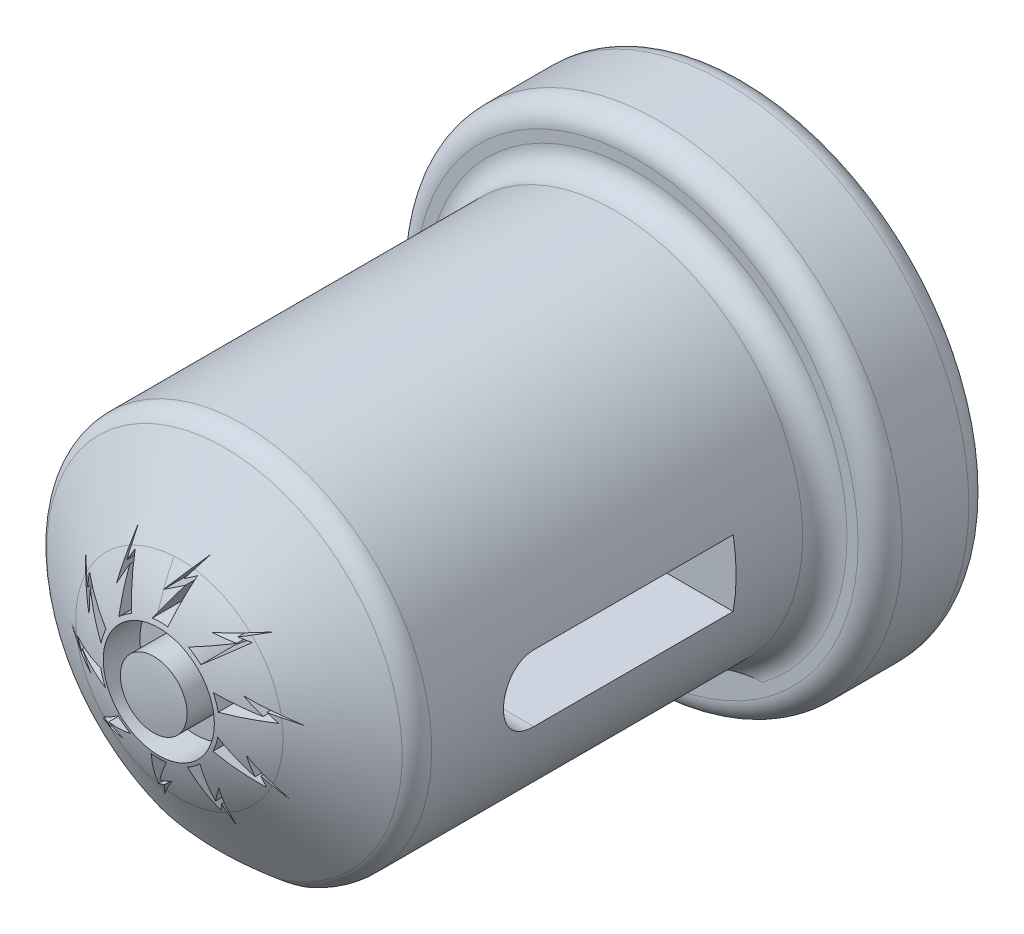
from build123d import *

# Parameters (mm, degrees)
SALIENTE_EXTRUIR1_DEPTH = 23.3
CROQUIS2_R              = 11
SALIENTE_EXTRUIR2_DEPTH = 5
CORTAR_EXTRUIR1_REACH   = 30.016
REDONDEO3_R             = 1
REDONDEO2_R             = 1
CROQUIS5_R              = 2.5
CROQUIS5_R_2            = 1.5
CORTAR_EXTRUIR2_DEPTH   = 2
CHAFL_N1_SIZE           = 0.5
CORTAR_EXTRUIR3_REACH   = 37.025


with BuildPart() as part:
    # Croquis1 → Saliente-Extruir1 (new body)
    with BuildSketch(Plane.XY):
        with BuildLine():
            Line((3.786999687, -7.609772229), (-3.786999687, -7.609772229))
            ThreePointArc((-3.786999687, -7.609772229), (0, 8.5), (3.786999687, -7.609772229))
        make_face()
        with BuildLine():
            Line((3, -4.609772229), (-3, -4.609772229))
            ThreePointArc((-3, -4.609772229), (0, 5.5), (3, -4.609772229))
        make_face(mode=Mode.SUBTRACT)
    extrude(amount=SALIENTE_EXTRUIR1_DEPTH)

    # Croquis2 → Saliente-Extruir2 (add)
    with BuildSketch(Plane(origin=(0, 0, 0), x_dir=(-1, 0, 0), z_dir=(0, 0, -1))):
        Circle(CROQUIS2_R)
        with BuildLine():
            Line((3, -4.609772229), (-3, -4.609772229))
            ThreePointArc((-3, -4.609772229), (0, 5.5), (3, -4.609772229))
        make_face(mode=Mode.SUBTRACT)
    extrude(amount=-SALIENTE_EXTRUIR2_DEPTH)

    # Croquis3 → Revolución1 (revolve)
    with BuildSketch(Plane(origin=(0, 0, 0), x_dir=(0, 0, -1), z_dir=(1, 0, 0))):
        with BuildLine():
            Line((-23.3, 0), (-23.3, 8.5))
            Line((-23.3, 8.5), (-25.625227866, 4.675672007))
            ThreePointArc((-25.625227866, 4.675672007), (-26.601446105, 2.427842124), (-26.935098395, 0))
            Line((-26.935098395, 0), (-23.3, 0))
        make_face()
    revolve(axis=Axis((0, 0, 26.935098395), (0, 0, -1)))

    # Croquis4 → Cortar-Extruir1 (cut, up to next)
    with BuildSketch(Plane(origin=(0, 0, 23.3), x_dir=(-1, 0, 0), z_dir=(0, 0, -1)), mode=Mode.PRIVATE) as cortar_extruir1_sk1:
        with BuildLine():
            Line((3.786999687, -7.609772229), (-3.786999687, -7.609772229))
            ThreePointArc((-3.786999687, -7.609772229), (0, -8.5), (3.786999687, -7.609772229))
        make_face()
    cortar_extruir1_tool1 = extrude(cortar_extruir1_sk1.sketch, amount=-CORTAR_EXTRUIR1_REACH, mode=Mode.PRIVATE) & part.part
    add(cortar_extruir1_tool1.solids().sort_by_distance((0, -7.967512, 23.3))[0], mode=Mode.SUBTRACT)

    # Redondeo3
    redondeo3_edges = [part.edges().sort_by_distance(p)[0] for p in [
        (11, 0, 0),
        (11, 0, 5),
        (0, 8.5, 5),
        (-8.274450554, 1.945113886, 23.3),
    ]]
    fillet(redondeo3_edges, radius=REDONDEO3_R)

    # Redondeo2
    redondeo2_edges = [part.edges().sort_by_distance(p)[0] for p in [
        (0, -4.609772229, 0),
        (0, 5.5, 0),
    ]]
    fillet(redondeo2_edges, radius=REDONDEO2_R)

    # Croquis5 → Cortar-Extruir2 (cut)
    # profile 1 of 11: a face of its own
    with BuildSketch(Plane.XY.offset(26.935098395)):
        with Locations((0.025979011, -0.015198441)):
            Circle(CROQUIS5_R)
        with Locations((0.025979011, -0.015198441)):
            Circle(CROQUIS5_R_2, mode=Mode.SUBTRACT)
    # profile 2 of 11: a face of its own
    with BuildSketch(Plane.XY.offset(26.935098395)):
        with BuildLine():
            Line((1.302557766, 2.344074393), (2.881616708, 2.973814702))
            Line((2.881616708, 2.973814702), (1.998734761, 3.074340177))
            Line((1.998734761, 3.074340177), (3.892874702, 3.589350961))
            Line((3.892874702, 3.589350961), (2.860263918, 3.177538192))
            Line((2.860263918, 3.177538192), (3.350806324, 3.121684736))
            Line((3.350806324, 3.121684736), (1.868869662, 1.932624716))
            ThreePointArc((1.868869662, 1.932624716), (1.599104223, 2.156780008), (1.302557766, 2.344074393))
        make_face()
    # profile 3 of 11: a face of its own
    with BuildSketch(Plane.XY.offset(26.935098395)):
        with BuildLine():
            Line((-0.324020989, 2.662020265), (0.583312464, 4.099638436))
            Line((0.583312464, 4.099638436), (-0.190041428, 3.662020265))
            Line((-0.190041428, 3.662020265), (1.039634231, 5.192020265))
            Line((1.039634231, 5.192020265), (0.44629203, 4.251903346))
            Line((0.44629203, 4.251903346), (0.875979011, 4.495050543))
            Line((0.875979011, 4.495050543), (0.375979011, 2.662020265))
            ThreePointArc((0.375979011, 2.662020265), (0.025979011, 2.684801559), (-0.324020989, 2.662020265))
        make_face()
    # profile 4 of 11: a face of its own
    with BuildSketch(Plane.XY.offset(26.935098395)):
        with BuildLine():
            Line((2.431603727, 1.130771774), (4.079241313, 0.712094828))
            Line((4.079241313, 0.712094828), (3.424062205, 1.312366634))
            Line((3.424062205, 1.312366634), (5.259169351, 0.615671587))
            Line((5.259169351, 0.615671587), (4.181712206, 0.889461449))
            Line((4.181712206, 0.889461449), (4.545739511, 0.555941462))
            Line((4.545739511, 0.555941462), (2.647915623, 0.465032213))
            ThreePointArc((2.647915623, 0.465032213), (2.561425973, 0.804941801), (2.431603727, 1.130771774))
        make_face()
    # profile 5 of 11: a face of its own
    with BuildSketch(Plane.XY.offset(26.935098395)):
        with BuildLine():
            Line((2.631859712, -0.514447228), (3.718734384, -1.821621067))
            Line((3.718734384, -1.821621067), (3.541514267, -0.950886357))
            Line((3.541514267, -0.950886357), (4.61664006, -2.593173407))
            Line((4.61664006, -2.593173407), (3.905888563, -1.738359335))
            Line((3.905888563, -1.738359335), (4.004354709, -2.222152555))
            Line((4.004354709, -2.222152555), (2.415547816, -1.180186789))
            ThreePointArc((2.415547816, -1.180186789), (2.545370062, -0.854356816), (2.631859712, -0.514447228))
        make_face()
    # profile 6 of 11: a face of its own
    with BuildSketch(Plane.XY.offset(26.935098395)):
        with BuildLine():
            Line((1.82683474, -1.963164875), (1.937797316, -3.659539629))
            Line((1.937797316, -3.659539629), (2.30622825, -2.85093308))
            Line((2.30622825, -2.85093308), (2.210711181, -4.811514298))
            Line((2.210711181, -4.811514298), (2.138148245, -3.702185939))
            Line((2.138148245, -3.702185939), (1.933442511, -4.151459824))
            Line((1.933442511, -4.151459824), (1.260522844, -2.374614551))
            ThreePointArc((1.260522844, -2.374614551), (1.5570693, -2.187320167), (1.82683474, -1.963164875))
        make_face()
    # profile 7 of 11: a face of its own
    with BuildSketch(Plane.XY.offset(26.935098395)):
        with BuildLine():
            Line((0.324020989, -2.662020265), (-0.583312464, -4.099638436))
            Line((-0.583312464, -4.099638436), (0.190041428, -3.662020265))
            Line((0.190041428, -3.662020265), (-1.039634231, -5.192020265))
            Line((-1.039634231, -5.192020265), (-0.44629203, -4.251903346))
            Line((-0.44629203, -4.251903346), (-0.875979011, -4.495050543))
            Line((-0.875979011, -4.495050543), (-0.375979011, -2.662020265))
            ThreePointArc((-0.375979011, -2.662020265), (-0.025979011, -2.684801559), (0.324020989, -2.662020265))
        make_face()
    # profile 8 of 11: a face of its own
    with BuildSketch(Plane.XY.offset(26.935098395)):
        with BuildLine():
            Line((-1.302557766, -2.344074393), (-2.881616708, -2.973814702))
            Line((-2.881616708, -2.973814702), (-1.998734761, -3.074340177))
            Line((-1.998734761, -3.074340177), (-3.892874702, -3.589350961))
            Line((-3.892874702, -3.589350961), (-2.860263918, -3.177538192))
            Line((-2.860263918, -3.177538192), (-3.350806324, -3.121684736))
            Line((-3.350806324, -3.121684736), (-1.868869662, -1.932624716))
            ThreePointArc((-1.868869662, -1.932624716), (-1.599104223, -2.156780008), (-1.302557766, -2.344074393))
        make_face()
    # profile 9 of 11: a face of its own
    with BuildSketch(Plane.XY.offset(26.935098395)):
        with BuildLine():
            Line((-2.431603727, -1.130771774), (-4.079241313, -0.712094828))
            Line((-4.079241313, -0.712094828), (-3.424062205, -1.312366634))
            Line((-3.424062205, -1.312366634), (-5.259169351, -0.615671587))
            Line((-5.259169351, -0.615671587), (-4.181712206, -0.889461449))
            Line((-4.181712206, -0.889461449), (-4.545739511, -0.555941462))
            Line((-4.545739511, -0.555941462), (-2.647915623, -0.465032213))
            ThreePointArc((-2.647915623, -0.465032213), (-2.561425973, -0.804941801), (-2.431603727, -1.130771774))
        make_face()
    # profile 10 of 11: a face of its own
    with BuildSketch(Plane.XY.offset(26.935098395)):
        with BuildLine():
            Line((-2.631859712, 0.514447228), (-3.718734384, 1.821621067))
            Line((-3.718734384, 1.821621067), (-3.541514267, 0.950886357))
            Line((-3.541514267, 0.950886357), (-4.61664006, 2.593173407))
            Line((-4.61664006, 2.593173407), (-3.905888563, 1.738359335))
            Line((-3.905888563, 1.738359335), (-4.004354709, 2.222152555))
            Line((-4.004354709, 2.222152555), (-2.415547816, 1.180186789))
            ThreePointArc((-2.415547816, 1.180186789), (-2.545370062, 0.854356816), (-2.631859712, 0.514447228))
        make_face()
    # profile 11 of 11: a face of its own
    with BuildSketch(Plane.XY.offset(26.935098395)):
        with BuildLine():
            Line((-1.82683474, 1.963164875), (-1.937797316, 3.659539629))
            Line((-1.937797316, 3.659539629), (-2.30622825, 2.85093308))
            Line((-2.30622825, 2.85093308), (-2.210711181, 4.811514298))
            Line((-2.210711181, 4.811514298), (-2.138148245, 3.702185939))
            Line((-2.138148245, 3.702185939), (-1.933442511, 4.151459824))
            Line((-1.933442511, 4.151459824), (-1.260522844, 2.374614551))
            ThreePointArc((-1.260522844, 2.374614551), (-1.5570693, 2.187320167), (-1.82683474, 1.963164875))
        make_face()
    extrude(amount=-CORTAR_EXTRUIR2_DEPTH, mode=Mode.SUBTRACT)

    # Chaflán1
    chafl_n1_edges = [part.edges().sort_by_distance(p)[0] for p in [
        (0, 5.5, 23.3),
    ]]
    chamfer(chafl_n1_edges, length=CHAFL_N1_SIZE)

    # Croquis6 → Cortar-Extruir3 (cut, up to next)
    with BuildSketch(Plane(origin=(8.5, 0, 0), x_dir=(0, 0, -1), z_dir=(1, 0, 0)), mode=Mode.PRIVATE) as cortar_extruir3_sk1:
        with BuildLine():
            Line((-9, -1.5), (-9, 1.5))
            Line((-9, 1.5), (-18, 1.5))
            ThreePointArc((-18, 1.5), (-19.5, 0), (-18, -1.5))
            Line((-18, -1.5), (-9, -1.5))
        make_face()
    cortar_extruir3_tool1 = extrude(cortar_extruir3_sk1.sketch, amount=-CORTAR_EXTRUIR3_REACH, mode=Mode.PRIVATE) & part.part
    add(cortar_extruir3_tool1.solids().sort_by_distance((8.5, 0, 14.094555))[0], mode=Mode.SUBTRACT)


solid = part.part
